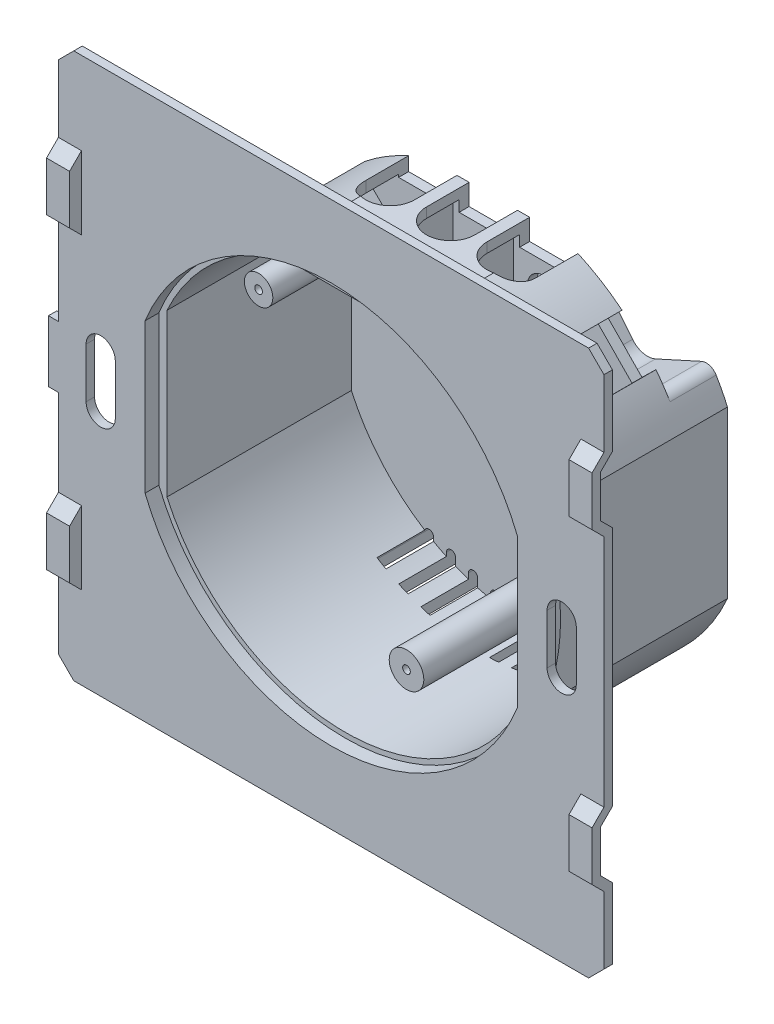
from build123d import *

# Parameters (mm, degrees)
BOSS_EXTRUDE1_DEPTH  = 1.1
SKETCH1_3_R          = 26.75
BOSS_EXTRUDE2_DEPTH  = 26
CUT_EXTRUDE1_START   = -24
CUT_EXTRUDE1_DEPTH   = 24
CUT_EXTRUDE2_START   = -6
SKETCH3_R            = 2.15
CUT_EXTRUDE2_DEPTH   = 6
SHELL2_START         = -24.7
SHELL2_OUTLINE_R     = 0.85
SHELL2_DEPTH         = 25.8
SHELL2_START_2       = -18.7
SHELL2_2_OUTLINE_R   = 0.85
SHELL2_2_DEPTH       = 19.8
SHELL2_START_3       = -0.7
SHELL2_3_DEPTH       = 1.8
SKETCH3_3_R          = 2.15
CUT_EXTRUDE3_DEPTH   = 58.869681181
CUT_EXTRUDE4_DEPTH   = 1.8
CUT_EXTRUDE8_DEPTH   = 2.73
CUT_EXTRUDE9_DEPTH   = 2.73
CUT_EXTRUDE10_DEPTH  = 2.73
FILLET1_R            = 1.5
CUT_EXTRUDE11_DEPTH  = 7.5
SKETCH16_R           = 1.85
BOSS_EXTRUDE4_DEPTH  = 6
BOSS_EXTRUDE7_START  = 6
SKETCH16_4_R         = 1.85
BOSS_EXTRUDE7_DEPTH  = 10
SKETCH16_3_R         = 2.25
BOSS_EXTRUDE5_DEPTH  = 16
SKETCH17_W           = 0.8
SKETCH17_H           = 9
BOSS_EXTRUDE10_DEPTH = 7.5
SKETCH21_R           = 0.5
CUT_EXTRUDE12_DEPTH  = 7.5
CUT_EXTRUDE13_DEPTH  = 58.869681228
SKETCH24_W           = 3
SKETCH24_H           = 9.5
BOSS_EXTRUDE11_DEPTH = 1.55
CHAMFER3_SIZE        = 1.55
CUT_EXTRUDE14_DEPTH  = 2.5
CUT_EXTRUDE15_START  = 33
CUT_EXTRUDE15_DEPTH  = 2.5
CHAMFER1_SIZE        = 2
BOSS_EXTRUDE13_DEPTH = 1.8


# Read off the part's stored shape, not the designer's step: Shell2, Cut-Extrude15
with BuildPart() as part:
    # Sketch1 → Boss-Extrude1 (new body)
    with BuildSketch(Plane.XY):
        Polygon((-35.5, 35.5), (35.5, 35.5), (35.5, -35.5), (-35.5, -35.5), (-35.5, -4), (-36.8, -4), (-36.8, 4), (-35.5, 4), align=None)
    extrude(amount=BOSS_EXTRUDE1_DEPTH)

    # Sketch1<3> → Boss-Extrude2 (add)
    with BuildSketch(Plane.XY):
        Circle(SKETCH1_3_R)
    extrude(amount=-BOSS_EXTRUDE2_DEPTH)

    # Sketch2 → Cut-Extrude1 (cut)
    with BuildSketch(Plane(origin=(0, 0, -26), x_dir=(-1, 0, 0), z_dir=(0, 0, -1)).offset(CUT_EXTRUDE1_START)):
        with BuildLine():
            Line((-24.475, -10.795224639), (-24.475, 10.795224639))
            ThreePointArc((-24.475, 10.795224639), (-26.75, 0), (-24.475, -10.795224639))
        make_face()
        with BuildLine():
            ThreePointArc((26.75, 0), (26.175071633, 5.516169414), (24.475, 10.795224639))
            Line((24.475, 10.795224639), (24.475, -10.795224639))
            ThreePointArc((24.475, -10.795224639), (26.175071633, -5.516169414), (26.75, 0))
        make_face()
        with BuildLine():
            ThreePointArc((8.657577076, 25.310252057), (0, 26.75), (-8.657577076, 25.310252057))
            Line((-8.657577076, 25.310252057), (8.657577076, 25.310252057))
        make_face()
    extrude(amount=CUT_EXTRUDE1_DEPTH, mode=Mode.SUBTRACT)

    # Sketch3 → Cut-Extrude2 (cut)
    with BuildSketch(Plane(origin=(0, 0, -26), x_dir=(-1, 0, 0), z_dir=(0, 0, -1)).offset(CUT_EXTRUDE2_START)):
        with BuildLine():
            Line((-12.1224617, 12.248972393), (-8.875, 16.310252057))
            Line((-8.875, 16.310252057), (8.875, 16.310252057))
            Line((8.875, 16.310252057), (12.1224617, 12.248972393))
            ThreePointArc((12.1224617, 12.248972393), (13.493143769, 11.378906066), (15.109209482, 11.534200487))
            Line((15.109209482, 11.534200487), (22.285955844, 14.795224639))
            ThreePointArc((22.285955844, 14.795224639), (16.34065506, 21.17889261), (8.657577076, 25.310252057))
            Line((8.657577076, 25.310252057), (-8.657577076, 25.310252057))
            ThreePointArc((-8.657577076, 25.310252057), (-16.34065506, 21.17889261), (-22.285955844, 14.795224639))
            Line((-22.285955844, 14.795224639), (-15.109209482, 11.534200487))
            ThreePointArc((-15.109209482, 11.534200487), (-13.493143769, 11.378906066), (-12.1224617, 12.248972393))
        make_face()
        with Locations((0, 18.810252057)):
            Circle(SKETCH3_R, mode=Mode.SUBTRACT)
    extrude(amount=CUT_EXTRUDE2_DEPTH, mode=Mode.SUBTRACT)

    # Shell2 outline → Shell2 (cut)
    with BuildSketch(Plane.XY.offset(SHELL2_START)):
        with BuildLine():
            Line((23.175, -10.517693426), (23.175, 10.517693426))
            ThreePointArc((23.175, 10.517693426), (22.522485957, 11.850743702), (21.793374282, 13.143490305))
            Line((21.793374282, 13.143490305), (15.646998413, 10.350653671))
            ThreePointArc((15.646998413, 10.350653671), (13.190578529, 10.114606151), (11.107141784, 11.437106968))
            Line((11.107141784, 11.437106968), (8.25, 15.010252057))
            Line((8.25, 15.010252057), (-8.25, 15.010252057))
            Line((-8.25, 15.010252057), (-11.107141784, 11.437106968))
            ThreePointArc((-11.107141784, 11.437106968), (-13.190578529, 10.114606151), (-15.646998413, 10.350653671))
            Line((-15.646998413, 10.350653671), (-21.793374282, 13.143490305))
            ThreePointArc((-21.793374282, 13.143490305), (-22.522485957, 11.850743702), (-23.175, 10.517693426))
            Line((-23.175, 10.517693426), (-23.175, -10.517693426))
            ThreePointArc((-23.175, -10.517693426), (0, -25.45), (23.175, -10.517693426))
        make_face()
        with Locations((0, 18.810252057)):
            Circle(SHELL2_OUTLINE_R)
    extrude(amount=SHELL2_DEPTH, mode=Mode.SUBTRACT)

    # Shell2 2 outline → Shell2 2 (cut)
    with BuildSketch(Plane.XY.offset(SHELL2_START_2)):
        with BuildLine():
            Line((15.646998413, 10.350653671), (21.793374282, 13.143490305))
            ThreePointArc((21.793374282, 13.143490305), (16.062844927, 19.740504371), (8.438619329, 24.010252057))
            Line((8.438619329, 24.010252057), (-8.438619329, 24.010252057))
            ThreePointArc((-8.438619329, 24.010252057), (-16.062844927, 19.740504371), (-21.793374282, 13.143490305))
            Line((-21.793374282, 13.143490305), (-15.646998413, 10.350653671))
            ThreePointArc((-15.646998413, 10.350653671), (-13.190578529, 10.114606151), (-11.107141784, 11.437106968))
            Line((-11.107141784, 11.437106968), (-8.25, 15.010252057))
            Line((-8.25, 15.010252057), (8.25, 15.010252057))
            Line((8.25, 15.010252057), (11.107141784, 11.437106968))
            ThreePointArc((11.107141784, 11.437106968), (13.190578529, 10.114606151), (15.646998413, 10.350653671))
        make_face()
        with Locations((0, 18.810252057)):
            Circle(SHELL2_2_OUTLINE_R, mode=Mode.SUBTRACT)
    extrude(amount=SHELL2_2_DEPTH, mode=Mode.SUBTRACT)

    # Shell2 3 outline → Shell2 3 (cut)
    with BuildSketch(Plane.XY.offset(SHELL2_START_3)):
        with BuildLine():
            ThreePointArc((23.175, -10.517693426), (25.45, 0), (23.175, 10.517693426))
            Line((23.175, 10.517693426), (23.175, -10.517693426))
        make_face()
        with BuildLine():
            ThreePointArc((-23.175, 10.517693426), (-25.45, 0), (-23.175, -10.517693426))
            Line((-23.175, -10.517693426), (-23.175, 10.517693426))
        make_face()
        with BuildLine():
            Line((-8.438619329, 24.010252057), (8.438619329, 24.010252057))
            ThreePointArc((8.438619329, 24.010252057), (0, 25.45), (-8.438619329, 24.010252057))
        make_face()
    extrude(amount=SHELL2_3_DEPTH, mode=Mode.SUBTRACT)

    # Sketch3<3> → Cut-Extrude3 (cut, through all)
    with BuildSketch(Plane(origin=(0, 0, -26), x_dir=(-1, 0, 0), z_dir=(0, 0, -1))):
        with Locations((-14.075, 13.810252057)):
            Circle(SKETCH3_3_R)
        with Locations((-7.875, 18.810252057)):
            Circle(SKETCH3_3_R)
        with Locations((7.875, 18.810252057)):
            Circle(SKETCH3_3_R)
        with Locations((14.075, 13.810252057)):
            Circle(SKETCH3_3_R)
        with Locations((0, 18.810252057)):
            Circle(SKETCH3_3_R)
    extrude(amount=-CUT_EXTRUDE3_DEPTH, mode=Mode.SUBTRACT)

    # Sketch6 → Cut-Extrude4 (cut)
    with BuildSketch(Plane.XY.offset(1.1)):
        with BuildLine():
            Line((24.225, -9.713875385), (24.225, 9.713875385))
            ThreePointArc((24.225, 9.713875385), (0, 26.1), (-24.225, 9.713875385))
            Line((-24.225, 9.713875385), (-24.225, -9.713875385))
            ThreePointArc((-24.225, -9.713875385), (0, -26.1), (24.225, -9.713875385))
        make_face()
    extrude(amount=-CUT_EXTRUDE4_DEPTH, mode=Mode.SUBTRACT)

    # Sketch8 → Cut-Extrude8 (cut)
    with BuildSketch(Plane(origin=(0, 25.310252057, 0), x_dir=(1, 0, 0), z_dir=(0, 1, 0))):
        with BuildLine():
            Line((-11.025, 20), (-4.725, 20))
            Line((-4.725, 20), (-4.725, 14.45))
            ThreePointArc((-4.725, 14.45), (-7.875, 11.3), (-11.025, 14.45))
            Line((-11.025, 14.45), (-11.025, 20))
        make_face()
        with BuildLine():
            Line((4.725, 20), (11.025, 20))
            Line((11.025, 20), (11.025, 14.45))
            ThreePointArc((11.025, 14.45), (7.875, 11.3), (4.725, 14.45))
            Line((4.725, 14.45), (4.725, 20))
        make_face()
        with BuildLine():
            Line((-3.15, 20), (3.15, 20))
            Line((3.15, 20), (3.15, 14.45))
            ThreePointArc((3.15, 14.45), (0, 11.3), (-3.15, 14.45))
            Line((-3.15, 14.45), (-3.15, 20))
        make_face()
    extrude(amount=-CUT_EXTRUDE8_DEPTH, mode=Mode.SUBTRACT)

    # Sketch11 → Cut-Extrude9 (cut)
    with BuildSketch(Plane(origin=(-19.093829516, 18.734678391, -20), x_dir=(0, 0, -1), z_dir=(0.7137880193068274, -0.7003618089916355, 0))):
        with BuildLine():
            Line((0, -3.15), (0, 3.15))
            Line((0, 3.15), (-5.55, 3.15))
            ThreePointArc((-5.55, 3.15), (-8.7, 0), (-5.55, -3.15))
            Line((-5.55, -3.15), (0, -3.15))
        make_face()
    extrude(amount=CUT_EXTRUDE9_DEPTH, mode=Mode.SUBTRACT)

    # Sketch12 → Cut-Extrude10 (cut)
    with BuildSketch(Plane(origin=(19.093829516, 18.734678391, -20), x_dir=(0, 0, -1), z_dir=(0.7137880193068274, 0.7003618089916355, 0))):
        with BuildLine():
            Line((0, 3.15), (0, -3.15))
            Line((0, -3.15), (-5.55, -3.15))
            ThreePointArc((-5.55, -3.15), (-8.7, 0), (-5.55, 3.15))
            Line((-5.55, 3.15), (0, 3.15))
        make_face()
    extrude(amount=-CUT_EXTRUDE10_DEPTH, mode=Mode.SUBTRACT)

    # Fillet1
    fillet1_edges = [part.edges().sort_by_distance(p)[0] for p in [
        (-8.875, 16.310252057, -23),
        (8.875, 16.310252057, -23),
        (22.285955844, 14.795224639, -23),
        (-22.285955844, 14.795224639, -23),
        (-8.25, 15.010252057, -21.7),
        (8.25, 15.010252057, -21.7),
    ]]
    fillet(fillet1_edges, radius=FILLET1_R)

    # Sketch14 → Cut-Extrude11 (cut)
    with BuildSketch(Plane(origin=(0, 0, -26), x_dir=(-1, 0, 0), z_dir=(0, 0, -1))):
        with BuildLine():
            Line((-2.2, -28.202106658), (-2.2, -25.202106658))
            ThreePointArc((-2.2, -25.202106658), (-1.6, -24.602106658), (-1, -25.202106658))
            Line((-1, -25.202106658), (-1, -28.202106658))
            ThreePointArc((-1, -28.202106658), (-1.6, -28.802106658), (-2.2, -28.202106658))
        make_face()
        with BuildLine():
            Line((2.2, -28.202106658), (2.2, -25.202106658))
            ThreePointArc((2.2, -25.202106658), (1.6, -24.602106658), (1, -25.202106658))
            Line((1, -25.202106658), (1, -28.202106658))
            ThreePointArc((1, -28.202106658), (1.6, -28.802106658), (2.2, -28.202106658))
        make_face()
        with BuildLine():
            Line((-5.068914268, -27.324991544), (-5.068914268, -24.324991544))
            ThreePointArc((-5.068914268, -24.324991544), (-4.468914268, -23.724991544), (-3.868914268, -24.324991544))
            Line((-3.868914268, -24.324991544), (-3.868914268, -27.324991544))
            ThreePointArc((-3.868914268, -27.324991544), (-4.468914268, -27.924991544), (-5.068914268, -27.324991544))
        make_face()
        with BuildLine():
            Line((-7.937828536, -26.44787643), (-7.937828536, -23.44787643))
            ThreePointArc((-7.937828536, -23.44787643), (-7.337828536, -22.84787643), (-6.737828536, -23.44787643))
            Line((-6.737828536, -23.44787643), (-6.737828536, -26.44787643))
            ThreePointArc((-6.737828536, -26.44787643), (-7.337828536, -27.04787643), (-7.937828536, -26.44787643))
        make_face()
        with BuildLine():
            Line((-10.806742804, -25.570761316), (-10.806742804, -22.570761316))
            ThreePointArc((-10.806742804, -22.570761316), (-10.206742804, -21.970761316), (-9.606742804, -22.570761316))
            Line((-9.606742804, -22.570761316), (-9.606742804, -25.570761316))
            ThreePointArc((-9.606742804, -25.570761316), (-10.206742804, -26.170761316), (-10.806742804, -25.570761316))
        make_face()
        with BuildLine():
            Line((-13.675657072, -24.693646202), (-13.675657072, -21.693646202))
            ThreePointArc((-13.675657072, -21.693646202), (-13.075657072, -21.093646202), (-12.475657072, -21.693646202))
            Line((-12.475657072, -21.693646202), (-12.475657072, -24.693646202))
            ThreePointArc((-12.475657072, -24.693646202), (-13.075657072, -25.293646202), (-13.675657072, -24.693646202))
        make_face()
        with BuildLine():
            Line((5.068914268, -27.324991544), (5.068914268, -24.324991544))
            ThreePointArc((5.068914268, -24.324991544), (4.468914268, -23.724991544), (3.868914268, -24.324991544))
            Line((3.868914268, -24.324991544), (3.868914268, -27.324991544))
            ThreePointArc((3.868914268, -27.324991544), (4.468914268, -27.924991544), (5.068914268, -27.324991544))
        make_face()
        with BuildLine():
            Line((7.937828536, -26.44787643), (7.937828536, -23.44787643))
            ThreePointArc((7.937828536, -23.44787643), (7.337828536, -22.84787643), (6.737828536, -23.44787643))
            Line((6.737828536, -23.44787643), (6.737828536, -26.44787643))
            ThreePointArc((6.737828536, -26.44787643), (7.337828536, -27.04787643), (7.937828536, -26.44787643))
        make_face()
        with BuildLine():
            Line((10.806742804, -25.570761316), (10.806742804, -22.570761316))
            ThreePointArc((10.806742804, -22.570761316), (10.206742804, -21.970761316), (9.606742804, -22.570761316))
            Line((9.606742804, -22.570761316), (9.606742804, -25.570761316))
            ThreePointArc((9.606742804, -25.570761316), (10.206742804, -26.170761316), (10.806742804, -25.570761316))
        make_face()
        with BuildLine():
            Line((13.675657072, -24.693646202), (13.675657072, -21.693646202))
            ThreePointArc((13.675657072, -21.693646202), (13.075657072, -21.093646202), (12.475657072, -21.693646202))
            Line((12.475657072, -21.693646202), (12.475657072, -24.693646202))
            ThreePointArc((12.475657072, -24.693646202), (13.075657072, -25.293646202), (13.675657072, -24.693646202))
        make_face()
    extrude(amount=-CUT_EXTRUDE11_DEPTH, mode=Mode.SUBTRACT)

    # Sketch16 → Boss-Extrude4 (add)
    with BuildSketch(Plane.XY.offset(-24.7)):
        with Locations((-19.25, 10.810252057)):
            Circle(SKETCH16_R)
        with Locations((19.25, 10.810252057)):
            Circle(SKETCH16_R)
    extrude(amount=BOSS_EXTRUDE4_DEPTH)

    # Sketch16<4> → Boss-Extrude7 (add)
    with BuildSketch(Plane.XY.offset(-24.7).offset(BOSS_EXTRUDE7_START)):
        with Locations(Location((-19.25, 10.810252057, 0), (0, 0, 180))):
            Circle(SKETCH16_4_R)
        with Locations(Location((19.25, 10.810252057, 0), (0, 0, 180))):
            Circle(SKETCH16_4_R)
    extrude(amount=BOSS_EXTRUDE7_DEPTH)

    # Sketch16<3> → Boss-Extrude5 (add)
    with BuildSketch(Plane.XY.offset(-24.7)):
        with Locations(Location((0, -22.389747943, 0), (0, 0, 180))):
            Circle(SKETCH16_3_R)
    extrude(amount=BOSS_EXTRUDE5_DEPTH)

    # Sketch17 → Boss-Extrude10 (add)
    with BuildSketch(Plane.XY.offset(-18.7)):
        with BuildLine():
            ThreePointArc((-15.179343003, 20.427678429), (-15.501665174, 20.18417392), (-15.820081763, 19.93558409))
            Line((-15.820081762, 19.93558409), (-10.029328296, 14.253753542))
            Line((-10.029328296, 14.253753542), (-9.469038849, 14.824783957))
            Line((-9.469038849, 14.824783957), (-15.179343003, 20.427678429))
        make_face()
        with BuildLine():
            ThreePointArc((15.820081763, 19.93558409), (15.501665174, 20.18417392), (15.179343003, 20.427678429))
            Line((15.179343003, 20.427678429), (9.469038849, 14.824783957))
            Line((9.469038849, 14.824783957), (10.029328296, 14.253753542))
            Line((10.029328296, 14.253753542), (15.820081762, 19.93558409))
        make_face()
        with Locations((-4.325, 19.510252057)):
            Rectangle(SKETCH17_W, SKETCH17_H)
        with Locations((3.55, 19.510252057)):
            Rectangle(SKETCH17_W, SKETCH17_H)
    extrude(amount=BOSS_EXTRUDE10_DEPTH)

    # Sketch21 → Cut-Extrude12 (cut)
    with BuildSketch(Plane.XY.offset(-8.7)):
        with Locations((-19.25, 10.810252057)):
            Circle(SKETCH21_R)
        with Locations((19.25, 10.810252057)):
            Circle(SKETCH21_R)
        with Locations((0, -22.389747943)):
            Circle(SKETCH21_R)
    extrude(amount=-CUT_EXTRUDE12_DEPTH, mode=Mode.SUBTRACT)

    # Sketch22 → Cut-Extrude13 (cut, through all)
    with BuildSketch(Plane.XY.offset(1.1)):
        with BuildLine():
            Line((-31.9, 3.25), (-31.9, -3.25))
            ThreePointArc((-31.9, -3.25), (-30, -5.15), (-28.1, -3.25))
            Line((-28.1, -3.25), (-28.1, 3.25))
            ThreePointArc((-28.1, 3.25), (-30, 5.15), (-31.9, 3.25))
        make_face()
        with BuildLine():
            ThreePointArc((31.9, -3.25), (30, -5.15), (28.1, -3.25))
            Line((28.1, -3.25), (28.1, 3.25))
            ThreePointArc((28.1, 3.25), (30, 5.15), (31.9, 3.25))
            Line((31.9, 3.25), (31.9, -3.25))
        make_face()
    extrude(amount=-CUT_EXTRUDE13_DEPTH, mode=Mode.SUBTRACT)

    # Sketch24 → Boss-Extrude11 (add)
    with BuildSketch(Plane(origin=(0, 0, 1.1), x_dir=(-1, 0, 0), z_dir=(0, 0, -1))):
        with Locations((34, 20)):
            Rectangle(SKETCH24_W, SKETCH24_H)
        with Locations((34, -20)):
            Rectangle(SKETCH24_W, SKETCH24_H)
        with Locations((-34, -20)):
            Rectangle(SKETCH24_W, SKETCH24_H)
        with Locations((-34, 20)):
            Rectangle(SKETCH24_W, SKETCH24_H)
    extrude(amount=-BOSS_EXTRUDE11_DEPTH)

    # Chamfer3
    chamfer3_edges = [part.edges().sort_by_distance(p)[0] for p in [
        (34, 15.25, 2.65),
        (34, 24.75, 2.65),
        (34, -24.75, 2.65),
        (34, -15.25, 2.65),
        (-34, -24.75, 2.65),
        (-34, -15.25, 2.65),
        (-34, 15.25, 2.65),
        (-34, 24.75, 2.65),
    ]]
    chamfer(chamfer3_edges, length=CHAMFER3_SIZE - 0.0001)  # a hair under: the kernel refuses the full size

    # Sketch26 → Cut-Extrude14 (cut)
    with BuildSketch(Plane.ZY.offset(35.5)):
        Polygon((1.55, -17.255634919), (0, -15.705634919), (0, -24.294365081), (1.55, -22.744365081), align=None)
        Polygon((1.55, 22.744365081), (0, 24.294365081), (0, 15.705634919), (1.55, 17.255634919), align=None)
    extrude(amount=-CUT_EXTRUDE14_DEPTH, mode=Mode.SUBTRACT)

    # Cut-Extrude15 outline → Cut-Extrude15 (cut)
    with BuildSketch(Plane.YZ.offset(CUT_EXTRUDE15_START)):
        Polygon((17.255634919, 1.55), (15.705634919, 0), (24.294365081, 0), (22.744365081, 1.55), align=None)
        Polygon((-17.255634919, 1.55), (-22.744365081, 1.55), (-24.294365081, 0), (-15.705634919, 0), align=None)
    extrude(amount=CUT_EXTRUDE15_DEPTH, mode=Mode.SUBTRACT)

    # Chamfer1
    chamfer1_edges = [part.edges().sort_by_distance(p)[0] for p in [
        (-35.5, -35.5, 0.55),
        (35.5, -35.5, 0.55),
        (35.5, 35.5, 0.55),
        (-35.5, 35.5, 0.55),
    ]]
    chamfer(chamfer1_edges, length=CHAMFER1_SIZE)

    # Sketch28 → Boss-Extrude13 (add)
    with BuildSketch(Plane.XY.offset(-0.7)):
        with BuildLine():
            Line((-24.225, 7.800761181), (-24.225, -7.800761181))
            ThreePointArc((-24.225, -7.800761181), (-25.45, 0), (-24.225, 7.800761181))
        make_face()
        with BuildLine():
            Line((24.225, 7.800761181), (24.225, -7.800761181))
            ThreePointArc((24.225, -7.800761181), (25.45, 0), (24.225, 7.800761181))
        make_face()
    extrude(amount=BOSS_EXTRUDE13_DEPTH)


solid = part.part
